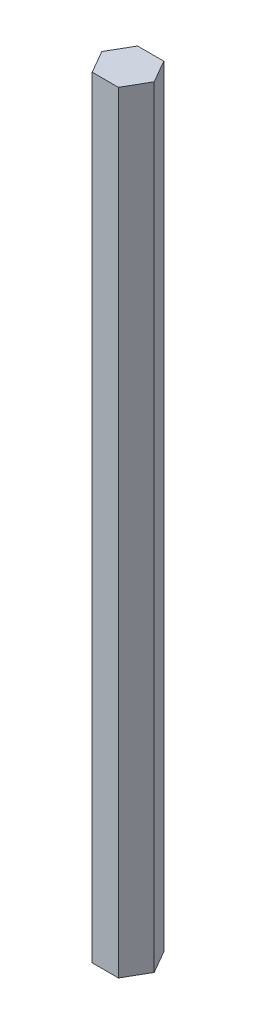
from build123d import *

# Parameters (mm, degrees)
BOSS_EXTRUDE1_DEPTH = 215.9


with BuildPart() as part:
    # Sketch1 → Boss-Extrude1 (new body)
    with BuildSketch(Plane(origin=(0, 0, 0), x_dir=(1, 0, 0), z_dir=(0, 1, 0))):
        Polygon((7.332348419, 0), (3.666174209, 6.35), (-3.666174209, 6.35), (-7.332348419, 0), (-3.666174209, -6.35), (3.666174209, -6.35), align=None)
    extrude(amount=BOSS_EXTRUDE1_DEPTH)


solid = part.part
